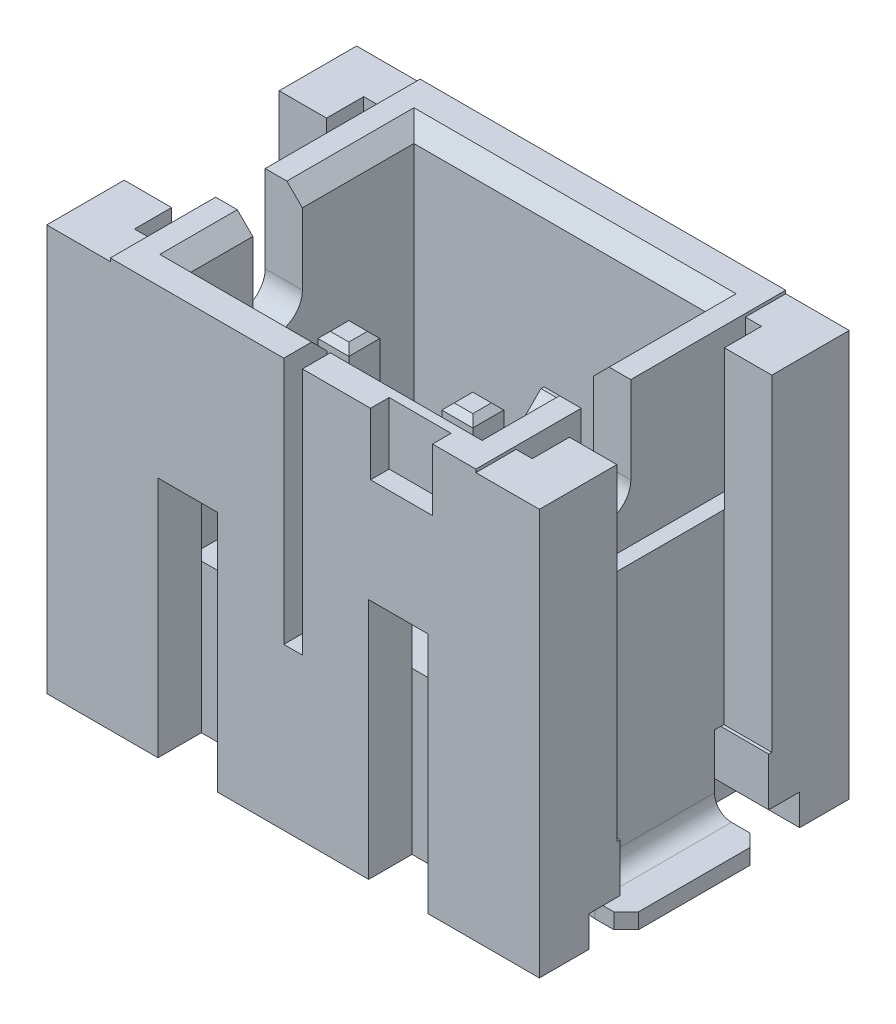
from build123d import *
from OCP.BRepFilletAPI import BRepFilletAPI_MakeChamfer

# Parameters (mm, degrees)
BODY1_W                               = 5.9
BODY1_H                               = 5
EXTRUDE_1_DEPTH                       = 6.6
SKETCH_2_W                            = 4.7
SKETCH_2_H                            = 3.6
CUT_EXTRUDE_1_DEPTH                   = 4.2
SKETCH_5_W                            = 0.8
SKETCH_5_H                            = 3.5
CUT_EXTRUDE_4_DEPTH                   = 0.8
SKETCH_8_W                            = 0.3
SKETCH_8_H                            = 4
CUT_EXTRUDE_6_DEPTH                   = 0.75
CUT_EXTRUDE_7_REACH                   = 12.167
SKETCH_10_W                           = 0.5
SKETCH_10_H                           = 1.6
EXTRUDE_2_DEPTH                       = 0.3
CHAMFER_2_SIZE                        = 0.25
EXTRUDE_6_DEPTH                       = 1.025
SKETCH_25_W                           = 2.5
SKETCH_25_H                           = 3
EXTRUDE_10_DEPTH                      = 0.25
SKETCH_26_W                           = 0.26
SKETCH_26_H                           = 3.7
CUT_EXTRUDE_10_DEPTH                  = 2.27
SKETCH_24_W                           = 2.2
SKETCH_24_H                           = 0.25
CHAMFER_13_SIZE                       = 0.2
CHAMFER_13_OF_MIRROR_4_SIZE           = 0.2
CHAMFER_9_SIZE                        = 0.25
SKETCH_27_W                           = 3.95
SKETCH_27_H                           = 4.2
CUT_EXTRUDE_14_DEPTH                  = 0.5
CHAMFER_14_SIZE                       = 0.5
SKETCH_23_W                           = 1
SKETCH_23_H                           = 0.3
CUT_EXTRUDE_9_DEPTH                   = 1
SWEEP_START                           = 1.7
SWEEP_1_DEPTH                         = 0.5
CHAMFER_8_SIZE                        = 0.1
SKETCH_22_W                           = 1.6
SKETCH_22_H                           = 2.55
EXTRUDE_9_DEPTH                       = 0.2
CHAMFER_10_SIZE                       = 0.072794047
CHAMFER_10_SIZE_2                     = 0.2
CHAMFER_11_SIZE2                      = 0.2
CHAMFER_11_SIZE                       = 0.549495484
PATTERN_LINEAR_5_COUNT                = 2
PATTERN_LINEAR_5_PITCH                = 2
CHAMFER_8_OF_PATTERN_LINEAR_5_SIZE    = 0.1
CHAMFER_10_OF_PATTERN_LINEAR_5_SIZE   = 0.072794047
CHAMFER_10_OF_PATTERN_LINEAR_5_SIZE_2 = 0.2
CHAMFER_11_OF_PATTERN_LINEAR_5_SIZE2  = 0.2
CHAMFER_11_OF_PATTERN_LINEAR_5_SIZE   = 0.549495484
SKETCH_4_W                            = 0.96
SKETCH_4_H                            = 3.91
CUT_EXTRUDE_3_DEPTH                   = 0.7
SKETCH_28_R                           = 0.05
CUT_EXTRUDE_15_DEPTH                  = 0.1


# Read off the part's stored shape, not the designer's step: По траектории1
with BuildPart() as part:
    # Body1 → Бобышка-Вытянуть1 (new body)
    with BuildSketch(Plane(origin=(0, 0, 0), x_dir=(1, 0, 0), z_dir=(0, 1, 0))):
        with Locations((2.95, -2.5)):
            Rectangle(BODY1_W, BODY1_H)
    extrude(amount=EXTRUDE_1_DEPTH)

    # Эскиз2 → Вырез-Вытянуть1 (cut)
    with BuildSketch(Plane(origin=(0, 6.6, 0), x_dir=(1, 0, 0), z_dir=(0, 1, 0))):
        with Locations((2.95, -2.5)):
            Rectangle(SKETCH_2_W, SKETCH_2_H)
    extrude(amount=-CUT_EXTRUDE_1_DEPTH, mode=Mode.SUBTRACT)

    # Эскиз5 → Вырез-Вытянуть4 (cut)
    with BuildSketch(Plane(origin=(0, 0, 4.8), x_dir=(1, 0, 0), z_dir=(0, 1, 0))):
        with Locations((1.95, 3.05)):
            Rectangle(SKETCH_5_W, SKETCH_5_H)
    cut_extrude_4 = extrude(amount=CUT_EXTRUDE_4_DEPTH, mode=Mode.SUBTRACT)

    # Эскиз8 → Вырез-Вытянуть6 (cut)
    with BuildSketch(Plane.XY.offset(4.3)):
        with Locations((2.95, 4.6)):
            Rectangle(SKETCH_8_W, SKETCH_8_H)
    extrude(amount=CUT_EXTRUDE_6_DEPTH, mode=Mode.SUBTRACT)

    # Эскиз9 → Вырез-Вытянуть7 (cut, up to next)
    with BuildSketch(Plane.ZY, mode=Mode.PRIVATE) as cut_extrude_7_sk1:
        with BuildLine():
            Line((2.5, 6.6), (3.3, 6.6))
            Line((3.3, 6.6), (3.3, 5.2))
            ThreePointArc((3.3, 5.2), (2.9, 4.8), (2.5, 5.2))
            Line((2.5, 5.2), (2.5, 6.6))
        make_face()
    cut_extrude_7_tool1 = extrude(cut_extrude_7_sk1.sketch, amount=-CUT_EXTRUDE_7_REACH, mode=Mode.PRIVATE) & part.part
    cut_extrude_7 = cut_extrude_7_tool1.solids().sort_by_distance((0, 5.740595, 2.9))[0]
    add(cut_extrude_7, mode=Mode.SUBTRACT)

    # Зеркальное отражение1: Вырез-Вытянуть7 across plane
    add(cut_extrude_7.mirror(Plane(origin=(2.95, 0, 0), x_dir=(0, 0, 1), z_dir=(1, 0, 0))), mode=Mode.SUBTRACT)

    # Эскиз10 → Бобышка-Вытянуть2 (add)
    with BuildSketch(Plane.XY.offset(0.7)):
        with Locations((2.95, 3.2)):
            Rectangle(SKETCH_10_W, SKETCH_10_H)
    extrude(amount=EXTRUDE_2_DEPTH)

    # Фаска2
    chamfer_2_edges = [part.edges().sort_by_distance(p)[0] for p in [
        (2.95, 4, 1),
    ]]
    chamfer(chamfer_2_edges, length=CHAMFER_2_SIZE)

    # Эскиз19 → Бобышка-Вытянуть6 (add)
    with BuildSketch(Plane.ZY):
        Polygon((5, 6.55), (3.75, 6.55), (3.75, 1.28), (3.7, 1.28), (3.7, 0.5), (4.2, 0.5), (4.2, 0), (5, 0), align=None)
        Polygon((1.25, 6.55), (1.25, 1.28), (1.3, 1.28), (1.3, 0.5), (0.8, 0.5), (0.8, 0), (0, 0), (0, 6.55), align=None)
    extrude_6 = extrude(amount=EXTRUDE_6_DEPTH)

    # Эскиз25 → Бобышка-Вытянуть10 (add)
    with BuildSketch(Plane.ZY):
        with Locations((2.5, 2.78)):
            Rectangle(SKETCH_25_W, SKETCH_25_H)
    extrude_10 = extrude(amount=EXTRUDE_10_DEPTH)

    # Эскиз26 → Вырез-Вытянуть10 (cut)
    with BuildSketch(Plane(origin=(0, 6.55, 0), x_dir=(1, 0, 0), z_dir=(0, 1, 0))):
        with Locations((-0.13, -2.5)):
            Rectangle(SKETCH_26_W, SKETCH_26_H)
    cut_extrude_10 = extrude(amount=-CUT_EXTRUDE_10_DEPTH, mode=Mode.SUBTRACT)

    # По траектории2: sweep along a curve in space
    with BuildLine() as sweep_2_path:
        Line((-0.525, 0, 2.5), (-1.025, 0, 2.5))
        ThreePointArc((-0.125, 0.4, 2.5), (-0.242157288, 0.117157288, 2.5), (-0.525, 0, 2.5))
        Line((-0.125, 0.4, 2.5), (-0.125, 1.28, 2.5))
    # Эскиз24 → По траектории2 (sweep)
    with BuildSketch(Plane.ZY.offset(1.025)):
        with Locations((2.5, 0)):
            Rectangle(SKETCH_24_W, SKETCH_24_H)
    sweep_2 = sweep(path=sweep_2_path.line)

    # Фаска13
    chamfer_13_edges = [part.edges().sort_by_distance(p)[0] for p in [
        (-1.025, 0, 1.4),
        (-1.025, 0, 3.6),
    ]]
    chamfer(chamfer_13_edges, length=CHAMFER_13_SIZE)

    # Зеркальное отражение4: Бобышка-Вытянуть6, Бобышка-Вытянуть10, Вырез-Вытянуть10, По траектории2 across plane
    add(extrude_6.mirror(Plane(origin=(2.95, 0, 0), x_dir=(0, 0, 1), z_dir=(1, 0, 0))))
    add(extrude_10.mirror(Plane(origin=(2.95, 0, 0), x_dir=(0, 0, 1), z_dir=(1, 0, 0))))
    add(cut_extrude_10.mirror(Plane(origin=(2.95, 0, 0), x_dir=(0, 0, 1), z_dir=(1, 0, 0))), mode=Mode.SUBTRACT)
    add(sweep_2.mirror(Plane(origin=(2.95, 0, 0), x_dir=(0, 0, 1), z_dir=(1, 0, 0))))

    # Фаска13 of Зеркальное отражение4
    chamfer_13_of_mirror_4_edges = [part.edges().sort_by_distance(p)[0] for p in [
        (6.925, 0, 1.4),
        (6.925, 0, 3.6),
    ]]
    chamfer(chamfer_13_of_mirror_4_edges, length=CHAMFER_13_OF_MIRROR_4_SIZE)

    # Фаска9
    chamfer_9_edges = [part.edges().sort_by_distance(p)[0] for p in [
        (5.3, 6.6, 3.8),
        (2.95, 6.6, 0.7),
        (0.6, 6.6, 1.6),
        (1.7, 6.6, 4.3),
        (4.2, 6.6, 4.3),
        (0.6, 6.6, 3.8),
        (5.3, 6.6, 1.6),
    ]]
    chamfer(chamfer_9_edges, length=CHAMFER_9_SIZE)

    # Эскиз27 → Вырез-Вытянуть14 (cut)
    with BuildSketch(Plane.XZ):
        with Locations((2.95, 2.1)):
            Rectangle(SKETCH_27_W, SKETCH_27_H)
    extrude(amount=-CUT_EXTRUDE_14_DEPTH, mode=Mode.SUBTRACT)

    # Фаска14
    chamfer_14_edges = [part.edges().sort_by_distance(p)[0] for p in [
        (4.925, 0.5, 2.1),
        (2.95, 0.5, 4.2),
        (0.975, 0.5, 2.1),
    ]]
    chamfer(chamfer_14_edges, length=CHAMFER_14_SIZE - 0.0001)  # a hair under: the kernel refuses the full size

    # Эскиз23 → Вырез-Вытянуть9 (cut)
    with BuildSketch(Plane(origin=(0, 6.6, 0), x_dir=(1, 0, 0), z_dir=(0, 1, 0))):
        with Locations((4.7, -4.85)):
            Rectangle(SKETCH_23_W, SKETCH_23_H)
    extrude(amount=-CUT_EXTRUDE_9_DEPTH, mode=Mode.SUBTRACT)

    # По траектории1 outline → По траектории1 (add)
    with BuildSketch(Plane.YZ.offset(SWEEP_START)):
        with BuildLine():
            add(Edge.make_bspline(
                [(-0.125, 2.425), (-0.125, 2.667776346), (-0.025307849, 2.907839696), (0.231543266, 3.164690811), (0.334064696, 3.233216063), (0.557970954, 3.325961072), (0.695280965, 3.349955156), (0.8, 3.35)],
                knots=[0.430009495, 0.430009495, 0.430009495, 0.430009495, 0.481572991, 0.481572991, 0.507354739, 0.507354739, 0.533136486, 0.533136486, 0.533136486, 0.533136486], degree=3))
            Line((-0.125, 2.425), (-0.125, -1.996089928))
            Line((-0.125, -1.996089928), (0.375, -1.996089928))
            Line((0.375, -1.996089928), (0.375, 2.425))
            add(Edge.make_bspline(
                [(0.375, 2.425), (0.375, 2.536545889), (0.420804502, 2.646845266), (0.538817176, 2.76485794), (0.585921617, 2.796342515), (0.688797466, 2.838955087), (0.728005499, 2.849979396), (0.8, 2.85)],
                knots=[0.430009495, 0.430009495, 0.430009495, 0.430009495, 0.481572991, 0.481572991, 0.507354739, 0.507354739, 0.533136486, 0.533136486, 0.533136486, 0.533136486], degree=3))
            Line((0.8, 2.85), (0.8, 3.35))
        make_face()
        with BuildLine():
            Line((2.4, 3.35), (2.4, 2.85))
            add(Edge.make_bspline(
                [(2.4, 2.85), (2.666666667, 2.85), (2.933333333, 2.85), (4, 2.85), (4.8, 2.85), (5.6, 2.85)],
                knots=[0.688757658, 0.688757658, 0.688757658, 0.688757658, 0.766568243, 0.766568243, 1, 1, 1, 1], degree=3))
            Line((5.6, 2.85), (5.6, 3.35))
            add(Edge.make_bspline(
                [(2.4, 3.35), (2.666666667, 3.35), (2.933333333, 3.35), (4, 3.35), (4.8, 3.35), (5.6, 3.35)],
                knots=[0.688757658, 0.688757658, 0.688757658, 0.688757658, 0.766568243, 0.766568243, 1, 1, 1, 1], degree=3))
        make_face()
    sweep_1 = extrude(amount=SWEEP_1_DEPTH)

    # Фаска8
    chamfer_8_edges = [part.edges().sort_by_distance(p)[0] for p in [
        (1.95, -0.125, -1.996089928),
        (2.2, 0.125, -1.996089928),
        (1.95, 0.375, -1.996089928),
        (1.7, 0.125, -1.996089928),
        (1.95, 5.6, 2.85),
        (2.2, 5.6, 3.1),
        (1.95, 5.6, 3.35),
        (1.7, 5.6, 3.1),
    ]]
    chamfer(chamfer_8_edges, length=CHAMFER_8_SIZE)

    # Эскиз22 → Бобышка-Вытянуть9 (add)
    with BuildSketch(Plane(origin=(0, 2.4, 0), x_dir=(1, 0, 0), z_dir=(0, 1, 0))):
        with Locations((1.95, -3.025)):
            Rectangle(SKETCH_22_W, SKETCH_22_H)
    extrude_9 = extrude(amount=EXTRUDE_9_DEPTH)

    # Фаска10
    chamfer_10_edges_1 = [part.edges().sort_by_distance(p)[0] for p in [
        (1.15, 2.6, 3.025),
    ]]
    chamfer_10_side_1 = [part.faces().sort_by_distance(p)[0] for p in [
        (1.151455881, 2.6, 3.025),
    ]]
    chamfer_10_edges_2 = [part.edges().sort_by_distance(p)[0] for p in [
        (2.75, 2.6, 3.025),
    ]]
    chamfer_10_side_2 = [part.faces().sort_by_distance(p)[0] for p in [
        (2.75, 2.598544119, 3.025),
    ]]
    chamfer_10 = BRepFilletAPI_MakeChamfer(part.part.solid().wrapped)
    for e in chamfer_10_edges_1:
        chamfer_10.Add(CHAMFER_10_SIZE - 0.0001, CHAMFER_10_SIZE_2 - 0.0001, e.wrapped, chamfer_10_side_1[0].wrapped)
    for e in chamfer_10_edges_2:
        chamfer_10.Add(CHAMFER_10_SIZE_2 - 0.0001, CHAMFER_10_SIZE - 0.0001, e.wrapped, chamfer_10_side_2[0].wrapped)
    add(Compound.cast(chamfer_10.Shape()), mode=Mode.REPLACE)  # a hair under: the kernel refuses the full size

    # Фаска11
    chamfer_11_edges = [part.edges().sort_by_distance(p)[0] for p in [
        (1.95, 2.6, 1.75),
    ]]
    chamfer_11_side = [part.faces().sort_by_distance(p)[0] for p in [
        (1.95, 2.6, 1.754),
    ]]
    chamfer(chamfer_11_edges, length=CHAMFER_11_SIZE - 0.0001, length2=CHAMFER_11_SIZE2 - 0.0001, reference=chamfer_11_side[0])  # a hair under: the kernel refuses the full size

    # Линейный массив5: Вырез-Вытянуть4, По траектории1, Бобышка-Вытянуть9 ×2
    with Locations(*[(i * PATTERN_LINEAR_5_PITCH, 0, 0) for i in range(1, PATTERN_LINEAR_5_COUNT)]):
        add(cut_extrude_4, mode=Mode.SUBTRACT)
        add(sweep_1)
        add(extrude_9)

    # Фаска8 of Линейный массив5
    chamfer_8_of_pattern_linear_5_edges = [part.edges().sort_by_distance(p)[0] for p in [
        (3.95, -0.125, -1.996089928),
        (4.2, 0.125, -1.996089928),
        (3.95, 0.375, -1.996089928),
        (3.7, 0.125, -1.996089928),
        (3.95, 5.6, 2.85),
        (4.2, 5.6, 3.1),
        (3.95, 5.6, 3.35),
        (3.7, 5.6, 3.1),
    ]]
    chamfer(chamfer_8_of_pattern_linear_5_edges, length=CHAMFER_8_OF_PATTERN_LINEAR_5_SIZE)

    # Фаска10 of Линейный массив5
    chamfer_10_of_pattern_linear_5_edges_1 = [part.edges().sort_by_distance(p)[0] for p in [
        (3.15, 2.6, 3.025),
    ]]
    chamfer_10_of_pattern_linear_5_side_1 = [part.faces().sort_by_distance(p)[0] for p in [
        (3.151455881, 2.6, 3.025),
    ]]
    chamfer_10_of_pattern_linear_5_edges_2 = [part.edges().sort_by_distance(p)[0] for p in [
        (4.75, 2.6, 3.025),
    ]]
    chamfer_10_of_pattern_linear_5_side_2 = [part.faces().sort_by_distance(p)[0] for p in [
        (4.748544119, 2.6, 3.025),
    ]]
    chamfer_10_of_pattern_linear_5 = BRepFilletAPI_MakeChamfer(part.part.solid().wrapped)
    for e in chamfer_10_of_pattern_linear_5_edges_1:
        chamfer_10_of_pattern_linear_5.Add(CHAMFER_10_OF_PATTERN_LINEAR_5_SIZE - 0.0001, CHAMFER_10_OF_PATTERN_LINEAR_5_SIZE_2 - 0.0001, e.wrapped, chamfer_10_of_pattern_linear_5_side_1[0].wrapped)
    for e in chamfer_10_of_pattern_linear_5_edges_2:
        chamfer_10_of_pattern_linear_5.Add(CHAMFER_10_OF_PATTERN_LINEAR_5_SIZE - 0.0001, CHAMFER_10_OF_PATTERN_LINEAR_5_SIZE_2 - 0.0001, e.wrapped, chamfer_10_of_pattern_linear_5_side_2[0].wrapped)
    add(Compound.cast(chamfer_10_of_pattern_linear_5.Shape()), mode=Mode.REPLACE)  # a hair under: the kernel refuses the full size

    # Фаска11 of Линейный массив5
    chamfer_11_of_pattern_linear_5_edges = [part.edges().sort_by_distance(p)[0] for p in [
        (3.95, 2.6, 1.75),
    ]]
    chamfer_11_of_pattern_linear_5_side = [part.faces().sort_by_distance(p)[0] for p in [
        (3.95, 2.6, 1.754),
    ]]
    chamfer(chamfer_11_of_pattern_linear_5_edges, length=CHAMFER_11_OF_PATTERN_LINEAR_5_SIZE - 0.0001, length2=CHAMFER_11_OF_PATTERN_LINEAR_5_SIZE2 - 0.0001, reference=chamfer_11_of_pattern_linear_5_side[0])  # a hair under: the kernel refuses the full size

    # Эскиз4 → Вырез-Вытянуть3 (cut)
    with BuildSketch(Plane.XY.offset(5)):
        with Locations((1.25, 1.955)):
            Rectangle(SKETCH_4_W, SKETCH_4_H)
        with Locations((4.65, 1.955)):
            Rectangle(SKETCH_4_W, SKETCH_4_H)
    extrude(amount=-CUT_EXTRUDE_3_DEPTH, mode=Mode.SUBTRACT)

    # Эскиз28 → Вырез-Вытянуть15 (cut)
    with BuildSketch(Plane.XZ.offset(0.125)):
        with Locations((-0.525, 2.5)):
            Circle(SKETCH_28_R)
    extrude(amount=-CUT_EXTRUDE_15_DEPTH, mode=Mode.SUBTRACT)


solid = part.part
